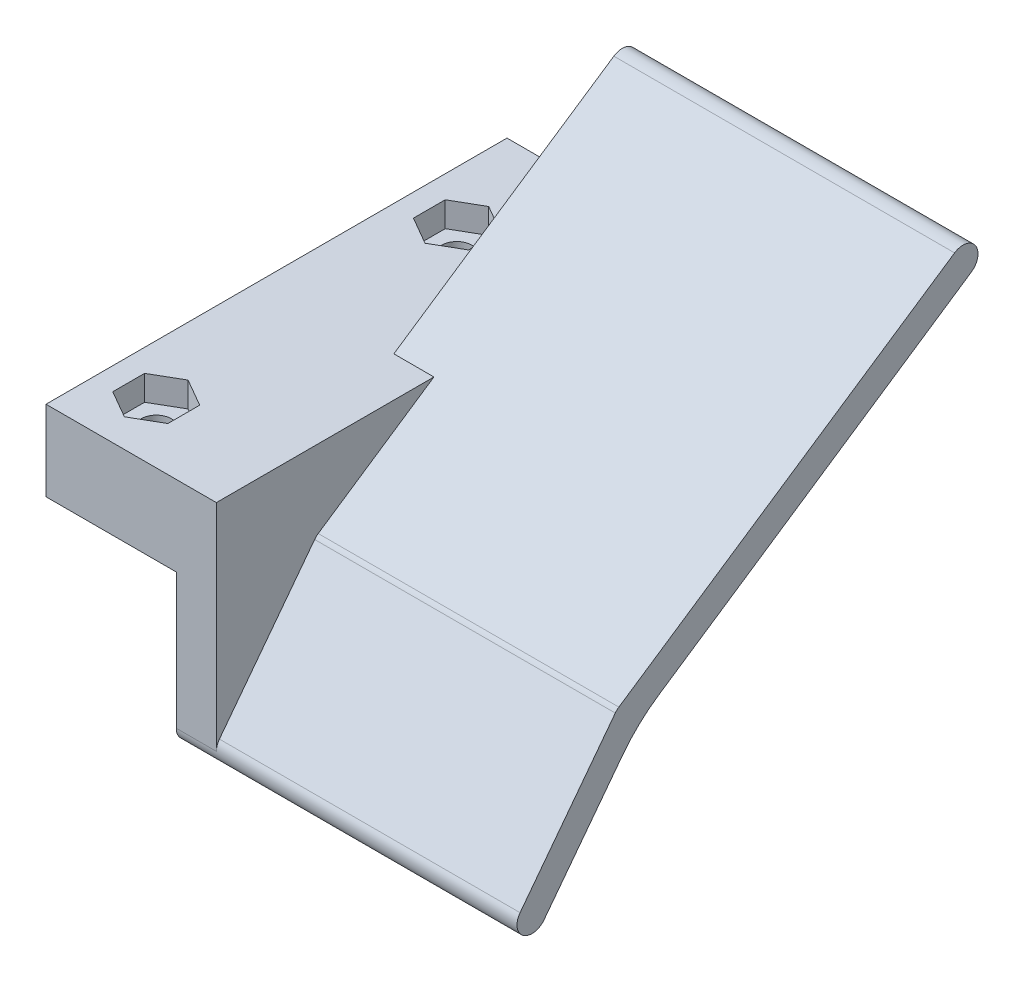
from build123d import *

# Parameters (mm, degrees)
SKETCH_1_W           = 13
SKETCH_1_H           = 46
SKETCH_1_R           = 1.5
EXTRUDE_1_DEPTH      = 8
EXTRUDE_2_DEPTH      = 15
EXTRUDE_2_DEPTH_BACK = 23
SKETCH_2_W           = 4
SKETCH_2_H           = 46
EXTRUDE_3_DEPTH      = 30
CUT_EXTRUDE_1_REACH  = 61.54
FILLET_1_R           = 15
CUT_EXTRUDE_2_DEPTH  = 2.5


with BuildPart() as part:
    # 草图1 → 凸台-拉伸1 (new body)
    with BuildSketch(Plane(origin=(0, 0, 0), x_dir=(1, 0, 0), z_dir=(0, 1, 0))):
        with Locations((62.5, -23)):
            Rectangle(SKETCH_1_W, SKETCH_1_H)
        with Locations((61, -10)):
            Circle(SKETCH_1_R, mode=Mode.SUBTRACT)
        with Locations((61, -40)):
            Circle(SKETCH_1_R, mode=Mode.SUBTRACT)
    extrude(amount=-EXTRUDE_1_DEPTH)

    # 草图2 → 凸台-拉伸2 (add, two sides: drawn at the far end of the back side and taken through both)
    with BuildSketch(Plane(origin=(0, 0, 0), x_dir=(1, 0, 0), z_dir=(0, 1, 0)).offset(-EXTRUDE_2_DEPTH_BACK)):
        with Locations((71, -23)):
            Rectangle(SKETCH_2_W, SKETCH_2_H)
    extrude(amount=EXTRUDE_2_DEPTH + EXTRUDE_2_DEPTH_BACK)

    # 草图4 → 凸台-拉伸3 (add)
    with BuildSketch(Plane(origin=(73, 0, 0), x_dir=(0, 0, -1), z_dir=(1, 0, 0))):
        with BuildLine():
            ThreePointArc((-0.663665725, 12.25479119), (-0.25479119, 14.336334275), (-2.336334275, 14.74520881))
            Line((-2.336334275, 14.74520881), (-35.836334275, -7.75479119))
            ThreePointArc((-35.836334275, -7.75479119), (-36.029223998, -7.908808925), (-36.194243291, -8.092375099))
            Line((-36.194243291, -8.092375099), (-45.694243291, -20.592375099))
            ThreePointArc((-45.694243291, -20.592375099), (-45.407624901, -22.694243291), (-43.305756709, -22.407624901))
            Line((-43.305756709, -22.407624901), (-33.956649522, -10.106168077))
            Line((-33.956649522, -10.106168077), (-0.663665725, 12.25479119))
        make_face()
    extrude(amount=EXTRUDE_3_DEPTH)

    # 草图5 → 切除-拉伸1 (cut, up to next)
    with BuildSketch(Plane(origin=(73, 0, 0), x_dir=(0, 0, -1), z_dir=(1, 0, 0)), mode=Mode.PRIVATE) as cut_extrude_1_sk1:
        with BuildLine():
            ThreePointArc((-1.5, 15), (-0.439339828, 14.560660172), (0, 13.5))
            Line((0, 13.5), (0, 15))
            Line((0, 15), (-1.5, 15))
        make_face()
    cut_extrude_1_tool1 = extrude(cut_extrude_1_sk1.sketch, amount=-CUT_EXTRUDE_1_REACH, mode=Mode.PRIVATE) & part.part
    # 草图5 → 切除-拉伸1 (cut, up to next)
    with BuildSketch(Plane(origin=(73, 0, 0), x_dir=(0, 0, -1), z_dir=(1, 0, 0)), mode=Mode.PRIVATE) as cut_extrude_1_sk2:
        with BuildLine():
            ThreePointArc((-43.305756709, -22.407624901), (-43.833455685, -22.843770321), (-44.5, -23))
            Line((-44.5, -23), (0, -23))
            Line((0, -23), (0, -8))
            Line((0, -8), (-30.820799275, -8))
            Line((-30.820799275, -8), (-33.956649522, -10.106168077))
            Line((-33.956649522, -10.106168077), (-43.305756709, -22.407624901))
        make_face()
    cut_extrude_1_tool2 = extrude(cut_extrude_1_sk2.sketch, amount=-CUT_EXTRUDE_1_REACH, mode=Mode.PRIVATE) & part.part
    # 草图5 → 切除-拉伸1 (cut, up to next)
    with BuildSketch(Plane(origin=(73, 0, 0), x_dir=(0, 0, -1), z_dir=(1, 0, 0)), mode=Mode.PRIVATE) as cut_extrude_1_sk3:
        with BuildLine():
            ThreePointArc((-44.5, -23), (-45.560660172, -22.560660172), (-46, -21.5))
            Line((-46, -21.5), (-46, -23))
            Line((-46, -23), (-44.5, -23))
        make_face()
    cut_extrude_1_tool3 = extrude(cut_extrude_1_sk3.sketch, amount=-CUT_EXTRUDE_1_REACH, mode=Mode.PRIVATE) & part.part
    # 草图5 → 切除-拉伸1 (cut, up to next)
    with BuildSketch(Plane(origin=(73, 0, 0), x_dir=(0, 0, -1), z_dir=(1, 0, 0)), mode=Mode.PRIVATE) as cut_extrude_1_sk4:
        with BuildLine():
            ThreePointArc((-2.336334275, 14.74520881), (-1.937142303, 14.934889058), (-1.5, 15))
            Line((-1.5, 15), (-46, 15))
            Line((-46, 15), (-46, 0))
            Line((-46, 0), (-24.290311837, 0))
            Line((-24.290311837, 0), (-2.336334275, 14.74520881))
        make_face()
    cut_extrude_1_tool4 = extrude(cut_extrude_1_sk4.sketch, amount=-CUT_EXTRUDE_1_REACH, mode=Mode.PRIVATE) & part.part
    add(cut_extrude_1_tool1.solids().sort_by_distance((73, 14.664948, 0.335052))[0], mode=Mode.SUBTRACT)
    add(cut_extrude_1_tool2.solids().sort_by_distance((73, -15.8958, 19.13623))[0], mode=Mode.SUBTRACT)
    add(cut_extrude_1_tool3.solids().sort_by_distance((73, -22.664948, 45.664948))[0], mode=Mode.SUBTRACT)
    add(cut_extrude_1_tool4.solids().sort_by_distance((73, 8.34941, 28.928584))[0], mode=Mode.SUBTRACT)

    # 圆角1
    fillet_1_edges = [part.edges().sort_by_distance(p)[0] for p in [
        (86, -10.106168077, 33.956649522),
    ]]
    fillet(fillet_1_edges, radius=FILLET_1_R)

    # 草图6 → 切除-拉伸2 (cut)
    with BuildSketch(Plane(origin=(0, 0, 0), x_dir=(1, 0, 0), z_dir=(0, 1, 0))):
        Polygon((63.75, -11.58771324), (63.75, -8.41228676), (61, -6.824573519), (58.25, -8.41228676), (58.25, -11.58771324), (61, -13.175426481), align=None)
        Polygon((61, -43.175426481), (63.75, -41.58771324), (63.75, -38.41228676), (61, -36.824573519), (58.25, -38.41228676), (58.25, -41.58771324), align=None)
    extrude(amount=-CUT_EXTRUDE_2_DEPTH, mode=Mode.SUBTRACT)


solid = part.part
